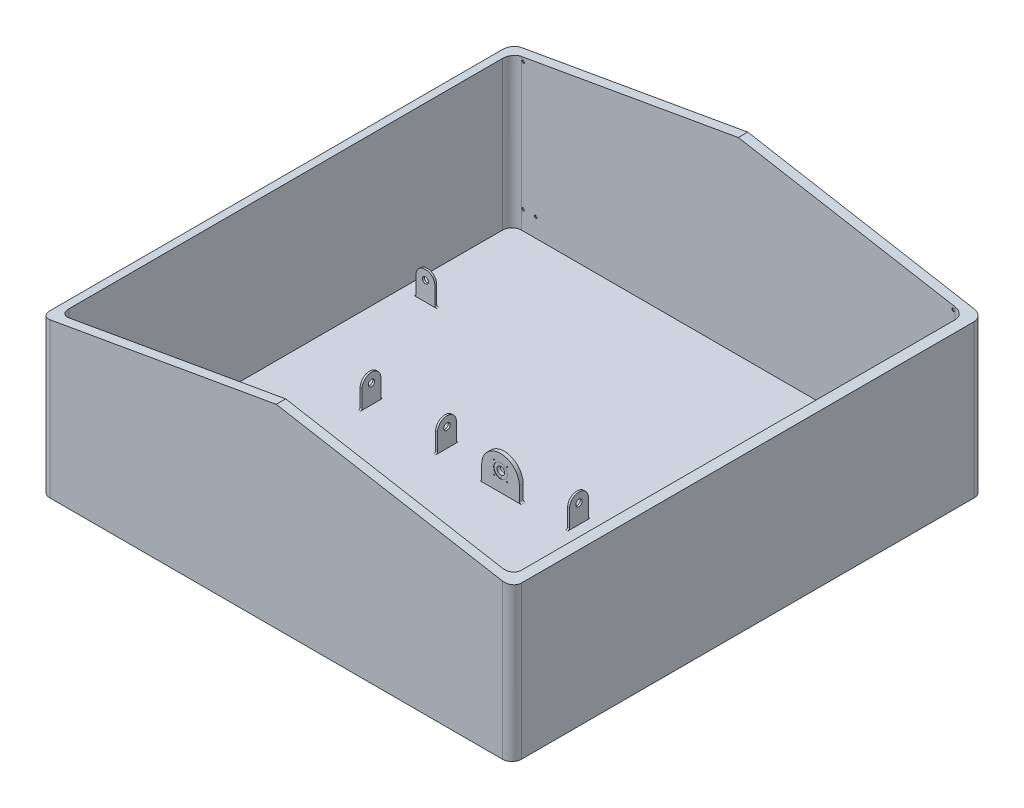
from build123d import *

# Parameters (mm, degrees)
EXTRUDE_1_DEPTH               = 30
EXTRUDE_2_DEPTH               = 1000
CUT_EXTRUDE_1_REACH           = 2980.825
SKETCH_4_R                    = 7.5
CUT_EXTRUDE_2_DEPTH           = 5
SKETCH_5_R                    = 7.5
CUT_EXTRUDE_3_DEPTH           = 5
MIRROR_2_COPY_1_SKETCH_R      = 7.5
MIRROR_2_COPY_1_DEPTH         = 5
MIRROR_2_COPY_2_SKETCH_R      = 7.5
MIRROR_2_COPY_2_DEPTH         = 5
SKETCH_6_R                    = 7.5
CUT_EXTRUDE_4_DEPTH           = 5
MIRROR_4_COPY_1_SKETCH_R      = 7.5
MIRROR_4_COPY_1_DEPTH         = 5
SKETCH_9_W                    = 100
SKETCH_9_H                    = 150
SKETCH_9_R                    = 17
SKETCH_9_R_2                  = 7.5
EXTRUDE_3_DEPTH               = 5
FILLET_1_RADIUS               = 50
FILLET_1_LENGTH               = 10
FILLET_2_R                    = 10
MIRROR_START                  = 615
MIRROR_6_OUTLINE_R            = 17
MIRROR_6_DEPTH                = 10
MIRROR_START_2                = -625
MIRROR_7_OUTLINE_R            = 17
MIRROR_7_DEPTH                = 10
MIRROR_7_2_OUTLINE_R          = 17
MIRROR_7_2_DEPTH              = 10
SKETCH_12_W                   = 10
SKETCH_12_H                   = 100
EXTRUDE_4_DEPTH               = 150
FILLET_3_RADIUS               = 50
FILLET_3_LENGTH               = 10
FILLET_4_RADIUS               = 50
FILLET_4_LENGTH               = 10
FILLET_5_R                    = 10
SKETCH_13_R                   = 17
CUT_EXTRUDE_6_DEPTH           = 700
FILLET_3_OF_MIRROR_8_2_RADIUS = 50
FILLET_3_OF_MIRROR_8_2_LENGTH = 10
FILLET_4_OF_MIRROR_8_2_RADIUS = 50
FILLET_4_OF_MIRROR_8_2_LENGTH = 10
FILLET_5_OF_MIRROR_8_R        = 10
SKETCH_11_W                   = 200
SKETCH_11_H                   = 20
EXTRUDE_5_DEPTH               = 180
SKETCH_14_R                   = 20
CUT_EXTRUDE_7_DEPTH           = 120
SKETCH_16_R                   = 2.75
CUT_EXTRUDE_8_DEPTH           = 10
SKETCH_17_R                   = 36.51
CUT_EXTRUDE_9_DEPTH           = 1.52
FILLET_6_R                    = 10
FILLET_7_RADIUS               = 100
FILLET_7_LENGTH               = 20
SKETCH_21_R                   = 17
SKETCH_21_R_2                 = 16
EXTRUDE_9_DEPTH               = 10
SKETCH_22_R                   = 17
SKETCH_22_R_2                 = 16
EXTRUDE_10_DEPTH              = 10


# Read off the part's stored shape, not the designer's step: Зеркальное отражение6, Зеркальное отражение7
with BuildPart() as part:
    # Эскиз1 → Бобышка-Вытянуть1 (new body)
    with BuildSketch(Plane(origin=(0, 0, 0), x_dir=(1, 0, 0), z_dir=(0, 1, 0))):
        with BuildLine():
            Line((-1200, -1250), (1200, -1250))
            ThreePointArc((1200, -1250), (1235.355339059, -1235.355339059), (1250, -1200))
            Line((1250, -1200), (1250, 1200))
            ThreePointArc((1250, 1200), (1235.355339059, 1235.355339059), (1200, 1250))
            Line((1200, 1250), (-1200, 1250))
            ThreePointArc((-1200, 1250), (-1235.355339059, 1235.355339059), (-1250, 1200))
            Line((-1250, 1200), (-1250, -1200))
            ThreePointArc((-1250, -1200), (-1235.355339059, -1235.355339059), (-1200, -1250))
        make_face()
    extrude(amount=EXTRUDE_1_DEPTH)

    # Эскиз2 → Бобышка-Вытянуть2 (add)
    with BuildSketch(Plane(origin=(0, 30, 0), x_dir=(1, 0, 0), z_dir=(0, 1, 0))):
        with BuildLine():
            Line((-1200, -1250), (1200, -1250))
            ThreePointArc((1200, -1250), (1235.355339059, -1235.355339059), (1250, -1200))
            Line((1250, -1200), (1250, 1200))
            ThreePointArc((1250, 1200), (1235.355339059, 1235.355339059), (1200, 1250))
            Line((1200, 1250), (-1200, 1250))
            ThreePointArc((-1200, 1250), (-1235.355339059, 1235.355339059), (-1250, 1200))
            Line((-1250, 1200), (-1250, -1200))
            ThreePointArc((-1250, -1200), (-1235.355339059, -1235.355339059), (-1200, -1250))
        make_face()
        with BuildLine():
            Line((-1150, -1200), (1150, -1200))
            ThreePointArc((1150, -1200), (1185.355339059, -1185.355339059), (1200, -1150))
            Line((1200, -1150), (1200, 1150))
            ThreePointArc((1200, 1150), (1185.355339059, 1185.355339059), (1150, 1200))
            Line((1150, 1200), (-1150, 1200))
            ThreePointArc((-1150, 1200), (-1185.355339059, 1185.355339059), (-1200, 1150))
            Line((-1200, 1150), (-1200, -1150))
            ThreePointArc((-1200, -1150), (-1185.355339059, -1185.355339059), (-1150, -1200))
        make_face(mode=Mode.SUBTRACT)
    extrude(amount=EXTRUDE_2_DEPTH)

    # Эскиз3 → Вырез-Вытянуть1 (cut, up to next)
    with BuildSketch(Plane.XY.offset(1250), mode=Mode.PRIVATE) as cut_extrude_1_sk1:
        Polygon((0, 1030), (1300, 800.774925079), (1300, 1030), (-1300, 1030), (-1300, 800.774925079), align=None)
    cut_extrude_1_tool1 = extrude(cut_extrude_1_sk1.sketch, amount=-CUT_EXTRUDE_1_REACH, mode=Mode.PRIVATE) & part.part
    add(cut_extrude_1_tool1.solids().sort_by_distance((654.532365, 941.091783, 1250))[0], mode=Mode.SUBTRACT)
    add(cut_extrude_1_tool1.solids().sort_by_distance((654.532365, 941.091783, 1250))[1], mode=Mode.SUBTRACT)

    # Эскиз4 → Вырез-Вытянуть2 (cut)
    with BuildSketch(Plane(origin=(0, 0, 1200), x_dir=(-1, 0, 0), z_dir=(0, 0, -1))):
        with Locations((-1140, 808.678709755)):
            Circle(SKETCH_4_R)
    cut_extrude_2 = extrude(amount=-CUT_EXTRUDE_2_DEPTH, mode=Mode.SUBTRACT)

    # Эскиз5 → Вырез-Вытянуть3 (cut)
    with BuildSketch(Plane(origin=(0, 0, 1200), x_dir=(-1, 0, 0), z_dir=(0, 0, -1))):
        with Locations((-1140, 130)):
            Circle(SKETCH_5_R)
    cut_extrude_3 = extrude(amount=-CUT_EXTRUDE_3_DEPTH, mode=Mode.SUBTRACT)

    # Зеркальное отражение1: Вырез-Вытянуть2, Вырез-Вытянуть3 across plane
    add(cut_extrude_2.mirror(Plane.XY), mode=Mode.SUBTRACT)
    add(cut_extrude_3.mirror(Plane.XY), mode=Mode.SUBTRACT)

    # Зеркальное отражение2: Вырез-Вытянуть2, Вырез-Вытянуть3 across plane
    add(cut_extrude_2.mirror(Plane(origin=(0, 0, 0), x_dir=(0, 0, 1), z_dir=(1, 0, 0))), mode=Mode.SUBTRACT)
    add(cut_extrude_3.mirror(Plane(origin=(0, 0, 0), x_dir=(0, 0, 1), z_dir=(1, 0, 0))), mode=Mode.SUBTRACT)

    # Зеркальное отражение2 copy 1 sketch → Зеркальное отражение2 copy 1 (cut)
    with BuildSketch(Plane.XY.offset(-1200)):
        with Locations((-1140, 808.678709755)):
            Circle(MIRROR_2_COPY_1_SKETCH_R)
    extrude(amount=-MIRROR_2_COPY_1_DEPTH, mode=Mode.SUBTRACT)

    # Зеркальное отражение2 copy 2 sketch → Зеркальное отражение2 copy 2 (cut)
    with BuildSketch(Plane.XY.offset(-1200)):
        with Locations((-1140, 130)):
            Circle(MIRROR_2_COPY_2_SKETCH_R)
    extrude(amount=-MIRROR_2_COPY_2_DEPTH, mode=Mode.SUBTRACT)

    # Эскиз6 → Вырез-Вытянуть4 (cut)
    with BuildSketch(Plane(origin=(0, 0, 1200), x_dir=(-1, 0, 0), z_dir=(0, 0, -1))):
        with Locations((-1074, 130)):
            Circle(SKETCH_6_R)
    cut_extrude_4 = extrude(amount=-CUT_EXTRUDE_4_DEPTH, mode=Mode.SUBTRACT)

    # Зеркальное отражение3: Вырез-Вытянуть4 across plane
    add(cut_extrude_4.mirror(Plane.XY), mode=Mode.SUBTRACT)

    # Зеркальное отражение4: Вырез-Вытянуть4 across plane
    add(cut_extrude_4.mirror(Plane(origin=(0, 0, 0), x_dir=(0, 0, 1), z_dir=(1, 0, 0))), mode=Mode.SUBTRACT)

    # Зеркальное отражение4 copy 1 sketch → Зеркальное отражение4 copy 1 (cut)
    with BuildSketch(Plane.XY.offset(-1200)):
        with Locations((-1074, 130)):
            Circle(MIRROR_4_COPY_1_SKETCH_R)
    extrude(amount=-MIRROR_4_COPY_1_DEPTH, mode=Mode.SUBTRACT)

    # Эскиз9 → Бобышка-Вытянуть3 (add, symmetric)
    # profile 1 of 2: a face of its own
    with BuildSketch(Plane.XY.offset(-620)):
        with Locations((-1074, 105)):
            Rectangle(SKETCH_9_W, SKETCH_9_H)
        with Locations((-1074, 130)):
            Circle(SKETCH_9_R, mode=Mode.SUBTRACT)
    # profile 2 of 2: a face of its own
    with BuildSketch(Plane.XY.offset(-620)):
        with Locations((-1074, 130)):
            Circle(SKETCH_9_R_2)
    extrude(amount=EXTRUDE_3_DEPTH, both=True)


with BuildPart() as extrude_3_kept_piece:
    # of the separate pieces the step leaves, the one the design keeps (extrude_3_pieces_kept)
    add(part.part.solids().sort_by_distance((-1200, 818.40762315, 1250))[0])

    # Скругление1: full round fillet: the end face becomes a half cylinder, R = half its width
    fillet_1_face = Plane((-1074, 180, -620), x_dir=(0, 0, 1), z_dir=(0, 1, 0))  # on the end face: x along it, z out of the body
    fillet_1_slab = fillet_1_face.offset(-FILLET_1_RADIUS / 2) * Box(FILLET_1_LENGTH, 2 * FILLET_1_RADIUS, FILLET_1_RADIUS, mode=Mode.PRIVATE)  # the body's end, R deep
    fillet_1_round = Plane((-1074, 130, -620), x_dir=(0, 1, 0), z_dir=(0, 0, 1)) * Cylinder(FILLET_1_RADIUS, FILLET_1_LENGTH, mode=Mode.PRIVATE)  # its axis R under the face
    add(fillet_1_slab - fillet_1_round, mode=Mode.SUBTRACT)

    # Скругление2
    fillet_2_edges = [extrude_3_kept_piece.edges().sort_by_distance(p)[0] for p in [
        (-1124, 30, -620),
        (-1024, 30, -620),
    ]]
    fillet(fillet_2_edges, radius=FILLET_2_R)

    # Зеркальное отражение6 outline → Зеркальное отражение6 (add)
    with BuildSketch(Plane.XY.offset(MIRROR_START)):
        with BuildLine():
            Line((-1024, 40), (-1024, 130))
            ThreePointArc((-1024, 130), (-1074, 180), (-1124, 130))
            Line((-1124, 130), (-1124, 40))
            ThreePointArc((-1124, 40), (-1126.928932188, 32.928932188), (-1134, 30))
            Line((-1134, 30), (-1014, 30))
            ThreePointArc((-1014, 30), (-1021.071067812, 32.928932188), (-1024, 40))
        make_face()
        with Locations((-1074, 130)):
            Circle(MIRROR_6_OUTLINE_R, mode=Mode.SUBTRACT)
    extrude(amount=MIRROR_6_DEPTH)

    # Зеркальное отражение7 outline → Зеркальное отражение7 (add)
    with BuildSketch(Plane.XY.offset(MIRROR_START_2)):
        with BuildLine():
            ThreePointArc((1124, 130), (1074, 180), (1024, 130))
            Line((1024, 130), (1024, 40))
            ThreePointArc((1024, 40), (1021.071067812, 32.928932188), (1014, 30))
            Line((1014, 30), (1134, 30))
            ThreePointArc((1134, 30), (1126.928932188, 32.928932188), (1124, 40))
            Line((1124, 40), (1124, 130))
        make_face()
        with Locations((1074, 130)):
            Circle(MIRROR_7_OUTLINE_R, mode=Mode.SUBTRACT)
    extrude(amount=MIRROR_7_DEPTH)

    # Mirror 7 2 outline → Mirror 7 2 (add)
    with BuildSketch(Plane.XY.offset(MIRROR_START)):
        with BuildLine():
            ThreePointArc((1124, 130), (1074, 180), (1024, 130))
            Line((1024, 130), (1024, 40))
            ThreePointArc((1024, 40), (1021.071067812, 32.928932188), (1014, 30))
            Line((1014, 30), (1134, 30))
            ThreePointArc((1134, 30), (1126.928932188, 32.928932188), (1124, 40))
            Line((1124, 40), (1124, 130))
        make_face()
        with Locations((1074, 130)):
            Circle(MIRROR_7_2_OUTLINE_R, mode=Mode.SUBTRACT)
    extrude(amount=MIRROR_7_2_DEPTH)

    # Эскиз12 → Бобышка-Вытянуть4 (add)
    with BuildSketch(Plane(origin=(0, 30, 0), x_dir=(1, 0, 0), z_dir=(0, 1, 0))):
        with Locations((-750, 0)):
            Rectangle(SKETCH_12_W, SKETCH_12_H)
        with Locations((-350, 0)):
            Rectangle(SKETCH_12_W, SKETCH_12_H)
    extrude_4 = extrude(amount=EXTRUDE_4_DEPTH)

    # Скругление3: full round fillet: the end face becomes a half cylinder, R = half its width
    fillet_3_face = Plane((-750, 180, 0), x_dir=(-1, 0, 0), z_dir=(0, 1, 0))  # on the end face: x along it, z out of the body
    fillet_3_slab = fillet_3_face.offset(-FILLET_3_RADIUS / 2) * Box(FILLET_3_LENGTH, 2 * FILLET_3_RADIUS, FILLET_3_RADIUS, mode=Mode.PRIVATE)  # the body's end, R deep
    fillet_3_round = Plane((-750, 130, 0), x_dir=(0, 1, 0), z_dir=(-1, 0, 0)) * Cylinder(FILLET_3_RADIUS, FILLET_3_LENGTH, mode=Mode.PRIVATE)  # its axis R under the face
    add(fillet_3_slab - fillet_3_round, mode=Mode.SUBTRACT)

    # Скругление4: full round fillet: the end face becomes a half cylinder, R = half its width
    fillet_4_face = Plane((-350, 180, 0), x_dir=(-1, 0, 0), z_dir=(0, 1, 0))  # on the end face: x along it, z out of the body
    fillet_4_slab = fillet_4_face.offset(-FILLET_4_RADIUS / 2) * Box(FILLET_4_LENGTH, 2 * FILLET_4_RADIUS, FILLET_4_RADIUS, mode=Mode.PRIVATE)  # the body's end, R deep
    fillet_4_round = Plane((-350, 130, 0), x_dir=(0, 1, 0), z_dir=(-1, 0, 0)) * Cylinder(FILLET_4_RADIUS, FILLET_4_LENGTH, mode=Mode.PRIVATE)  # its axis R under the face
    add(fillet_4_slab - fillet_4_round, mode=Mode.SUBTRACT)

    # Скругление5
    fillet_5_edges = [extrude_3_kept_piece.edges().sort_by_distance(p)[0] for p in [
        (-750, 30, 50),
        (-750, 30, -50),
        (-350, 30, 50),
        (-350, 30, -50),
    ]]
    fillet(fillet_5_edges, radius=FILLET_5_R)

    # Эскиз13 → Вырез-Вытянуть6 (cut)
    with BuildSketch(Plane(origin=(-345, 0, 0), x_dir=(0, 0, -1), z_dir=(1, 0, 0))):
        with Locations((0, 130)):
            Circle(SKETCH_13_R)
    cut_extrude_6 = extrude(amount=-CUT_EXTRUDE_6_DEPTH, mode=Mode.SUBTRACT)

    # Зеркальное отражение8: Бобышка-Вытянуть4, Вырез-Вытянуть6 across plane
    add(extrude_4.mirror(Plane(origin=(0, 0, 0), x_dir=(0, 0, 1), z_dir=(1, 0, 0))))
    add(cut_extrude_6.mirror(Plane(origin=(0, 0, 0), x_dir=(0, 0, 1), z_dir=(1, 0, 0))), mode=Mode.SUBTRACT)

    # Скругление3 of Mirror 8 2: full round fillet: the end face becomes a half cylinder, R = half its width
    fillet_3_of_mirror_8_2_face = Plane((750, 180, 0), x_dir=(1, 0, 0), z_dir=(0, 1, 0))  # on the end face: x along it, z out of the body
    fillet_3_of_mirror_8_2_slab = fillet_3_of_mirror_8_2_face.offset(-FILLET_3_OF_MIRROR_8_2_RADIUS / 2) * Box(FILLET_3_OF_MIRROR_8_2_LENGTH, 2 * FILLET_3_OF_MIRROR_8_2_RADIUS, FILLET_3_OF_MIRROR_8_2_RADIUS, mode=Mode.PRIVATE)  # the body's end, R deep
    fillet_3_of_mirror_8_2_round = Plane((750, 130, 0), x_dir=(0, 1, 0), z_dir=(1, 0, 0)) * Cylinder(FILLET_3_OF_MIRROR_8_2_RADIUS, FILLET_3_OF_MIRROR_8_2_LENGTH, mode=Mode.PRIVATE)  # its axis R under the face
    add(fillet_3_of_mirror_8_2_slab - fillet_3_of_mirror_8_2_round, mode=Mode.SUBTRACT)

    # Скругление4 of Mirror 8 2: full round fillet: the end face becomes a half cylinder, R = half its width
    fillet_4_of_mirror_8_2_face = Plane((350, 180, 0), x_dir=(1, 0, 0), z_dir=(0, 1, 0))  # on the end face: x along it, z out of the body
    fillet_4_of_mirror_8_2_slab = fillet_4_of_mirror_8_2_face.offset(-FILLET_4_OF_MIRROR_8_2_RADIUS / 2) * Box(FILLET_4_OF_MIRROR_8_2_LENGTH, 2 * FILLET_4_OF_MIRROR_8_2_RADIUS, FILLET_4_OF_MIRROR_8_2_RADIUS, mode=Mode.PRIVATE)  # the body's end, R deep
    fillet_4_of_mirror_8_2_round = Plane((350, 130, 0), x_dir=(0, 1, 0), z_dir=(1, 0, 0)) * Cylinder(FILLET_4_OF_MIRROR_8_2_RADIUS, FILLET_4_OF_MIRROR_8_2_LENGTH, mode=Mode.PRIVATE)  # its axis R under the face
    add(fillet_4_of_mirror_8_2_slab - fillet_4_of_mirror_8_2_round, mode=Mode.SUBTRACT)

    # Скругление5 of Зеркальное отражение8
    fillet_5_of_mirror_8_edges = [extrude_3_kept_piece.edges().sort_by_distance(p)[0] for p in [
        (750, 30, 50),
        (750, 30, -50),
        (350, 30, 50),
        (350, 30, -50),
    ]]
    fillet(fillet_5_of_mirror_8_edges, radius=FILLET_5_OF_MIRROR_8_R)

    # Эскиз11 → Бобышка-Вытянуть5 (add)
    with BuildSketch(Plane(origin=(0, 30, 0), x_dir=(1, 0, 0), z_dir=(0, 1, 0))):
        with Locations((0, -50.8)):
            Rectangle(SKETCH_11_W, SKETCH_11_H)
    extrude(amount=EXTRUDE_5_DEPTH)

    # Эскиз14 → Вырез-Вытянуть7 (cut)
    with BuildSketch(Plane.XY.offset(60.8)):
        with Locations((0, 130)):
            Circle(SKETCH_14_R)
    extrude(amount=-CUT_EXTRUDE_7_DEPTH, mode=Mode.SUBTRACT)

    # Эскиз16 → Вырез-Вытянуть8 (cut)
    with BuildSketch(Plane.XY.offset(60.8)):
        with Locations((-34.75, 164.75)):
            Circle(SKETCH_16_R)
        with Locations((-34.75, 95.25)):
            Circle(SKETCH_16_R)
        with Locations((34.75, 95.25)):
            Circle(SKETCH_16_R)
        with Locations((34.75, 164.75)):
            Circle(SKETCH_16_R)
    extrude(amount=-CUT_EXTRUDE_8_DEPTH, mode=Mode.SUBTRACT)

    # Эскиз17 → Вырез-Вытянуть9 (cut)
    with BuildSketch(Plane.XY.offset(60.8)):
        with Locations((0, 130)):
            Circle(SKETCH_17_R)
    extrude(amount=-CUT_EXTRUDE_9_DEPTH, mode=Mode.SUBTRACT)

    # Скругление6
    fillet_6_edges = [extrude_3_kept_piece.edges().sort_by_distance(p)[0] for p in [
        (-100, 30, 50.8),
        (100, 30, 50.8),
    ]]
    fillet(fillet_6_edges, radius=FILLET_6_R)

    # Скругление7: full round fillet: the end face becomes a half cylinder, R = half its width
    fillet_7_face = Plane((0, 210, 50.8), x_dir=(0, 0, -1), z_dir=(0, 1, 0))  # on the end face: x along it, z out of the body
    fillet_7_slab = fillet_7_face.offset(-FILLET_7_RADIUS / 2) * Box(FILLET_7_LENGTH, 2 * FILLET_7_RADIUS, FILLET_7_RADIUS, mode=Mode.PRIVATE)  # the body's end, R deep
    fillet_7_round = Plane((0, 110, 50.8), x_dir=(0, 1, 0), z_dir=(0, 0, -1)) * Cylinder(FILLET_7_RADIUS, FILLET_7_LENGTH, mode=Mode.PRIVATE)  # its axis R under the face
    add(fillet_7_slab - fillet_7_round, mode=Mode.SUBTRACT)

    # Эскиз21 → Бобышка-Вытянуть9 (add)
    with BuildSketch(Plane.XY.offset(625)):
        with Locations(Location((1074, 130, 0), (0, 0, 180))):
            Circle(SKETCH_21_R)
        with Locations((1074, 130)):
            Circle(SKETCH_21_R_2, mode=Mode.SUBTRACT)
    extrude(amount=-EXTRUDE_9_DEPTH)

    # Эскиз22 → Бобышка-Вытянуть10 (add)
    with BuildSketch(Plane.XY.offset(-615)):
        with Locations((-1074, 130)):
            Circle(SKETCH_22_R)
        with Locations((-1074, 130)):
            Circle(SKETCH_22_R_2, mode=Mode.SUBTRACT)
    extrude(amount=-EXTRUDE_10_DEPTH)


solid = extrude_3_kept_piece.part
